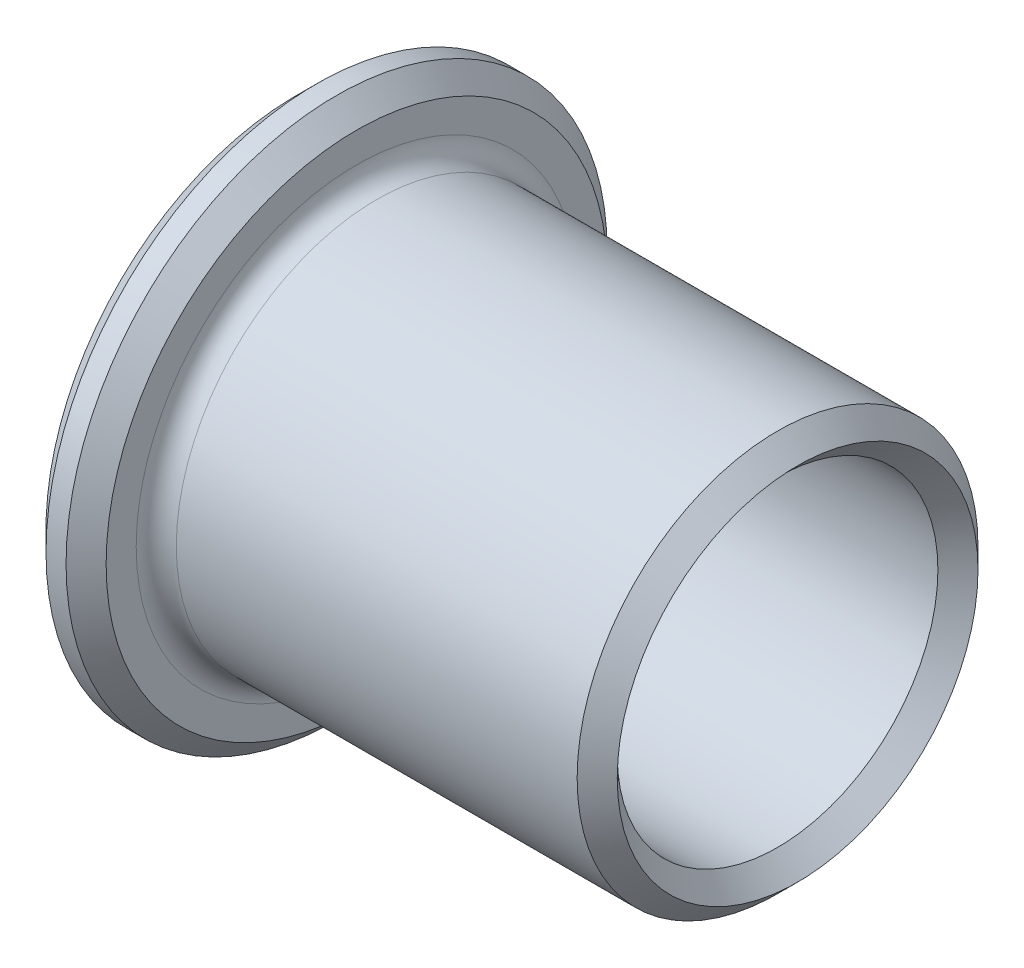
from build123d import *

# Parameters (mm, degrees)
CHAMFER1_SIZE = 1
FILLET1_R     = 1


with BuildPart() as part:
    # Sketch1 → Revolve1 (revolve)
    with BuildSketch(Plane.XY, mode=Mode.PRIVATE) as revolve1_sk:
        Polygon((0, 8), (25, 8), (25, 10), (3, 10), (3, 13.5), (0, 13.5), align=None)
    revolve(revolve1_sk.sketch.rotate(Axis((0, 0, 0), (1, 0, 0)), 90), axis=Axis((0, 0, 0), (1, 0, 0)))

    # Chamfer1
    chamfer1_edges = [part.edges().sort_by_distance(p)[0] for p in [
        (0, 0, -13.5),
        (3, 0, -13.5),
        (25, 0, -10),
        (25, 0, -8),
        (0, 0, -8),
    ]]
    chamfer(chamfer1_edges, length=CHAMFER1_SIZE - 0.0001)  # a hair under: the kernel refuses the full size

    # Fillet1
    fillet1_edges = [part.edges().sort_by_distance(p)[0] for p in [
        (3, 0, -10),
    ]]
    fillet(fillet1_edges, radius=FILLET1_R)


solid = part.part
